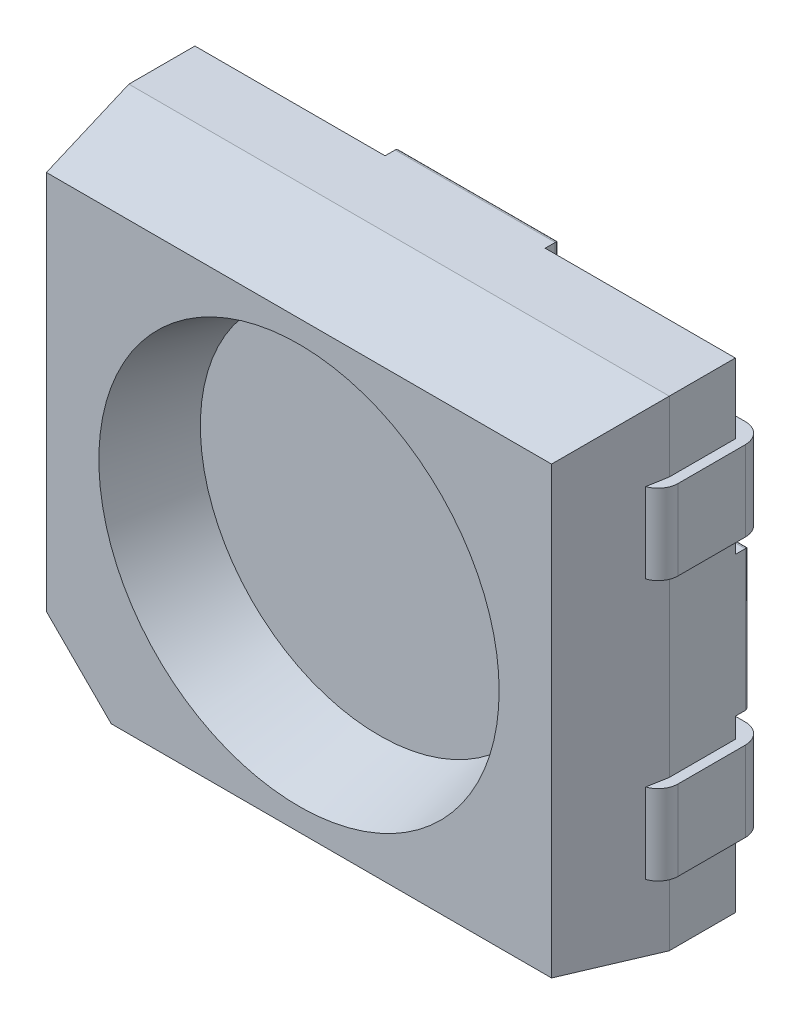
from build123d import *

# Parameters (mm, degrees)
BOSS_EXTRUDE1_START  = 0.03
SKETCH1_W            = 2.7
SKETCH1_H            = 2.4
BOSS_EXTRUDE1_DEPTH  = 0.4
BOSS_EXTRUDE2_START  = 0.43
SKETCH1_2_W          = 2.7
SKETCH1_2_H          = 2.4
BOSS_EXTRUDE2_DEPTH  = 0.5
BOSS_EXTRUDE2_TAPER  = 10
CUT_EXTRUDE1_DEPTH   = 0.3
SKETCH3_R            = 1
CUT_EXTRUDE2_DEPTH   = 0.4
CUT_EXTRUDE2_DRAFT   = -15
CUT_EXTRUDE3_DEPTH   = 0.07
BOSS_EXTRUDE3_START  = -0.5
SKETCH4_W            = 0.8
SKETCH4_H            = 0.4
BOSS_EXTRUDE3_DEPTH  = 0.53
FILLET2_R            = 0.1
MIRROR2_COPY_1_DEPTH = 0.07
FILLET1_R            = 0.02
FILLET2_OF_MIRROR3_R = 0.1
MIRROR4_START        = -0.85
MIRROR4_DEPTH        = 0.4


# Read off the part's stored shape, not the designer's step: Mirror4
with BuildPart() as part:
    # Sketch1 → Boss-Extrude1 (new body)
    with BuildSketch(Plane.XY.offset(BOSS_EXTRUDE1_START)):
        Rectangle(SKETCH1_W, SKETCH1_H)
    extrude(amount=BOSS_EXTRUDE1_DEPTH)

    # Sketch1<2> → Boss-Extrude2 (add)
    with BuildSketch(Plane.XY.offset(BOSS_EXTRUDE2_START)):
        Rectangle(SKETCH1_2_W, SKETCH1_2_H)
    extrude(amount=BOSS_EXTRUDE2_DEPTH, taper=BOSS_EXTRUDE2_TAPER)

    # Sketch2 → Cut-Extrude1 (cut)
    with BuildSketch(Plane.XY.offset(0.93)):
        Polygon((-0.85, -1.2), (-1.35, -0.7), (-1.35, -1.2), align=None)
    extrude(amount=-CUT_EXTRUDE1_DEPTH, mode=Mode.SUBTRACT)


with BuildPart() as cut_extrude2_tool:
    # Sketch3 → Cut-Extrude2 (with draft: the straight prism first)
    with BuildSketch(Plane.XY.offset(0.93)):
        Circle(SKETCH3_R)
    extrude(amount=-CUT_EXTRUDE2_DEPTH)
    # Cut-Extrude2: the draft: its side faces are tilted about the plane it starts from
    cut_extrude2_sides = [cut_extrude2_tool.faces().sort_by_distance(p)[0] for p in [
        (-1, 0, 0.73),
    ]]
    draft(cut_extrude2_sides, Plane.XY.offset(0.93), CUT_EXTRUDE2_DRAFT)


with BuildPart() as part_1:
    add(part.part)

    # Cut-Extrude2: cut by cut_extrude2_tool
    add(cut_extrude2_tool.part, mode=Mode.SUBTRACT)

    # Sketch5 → Cut-Extrude3 (cut)
    with BuildSketch(Plane(origin=(0, 0, 0.03), x_dir=(-1, 0, 0), z_dir=(0, 0, -1))):
        with BuildLine():
            Line((-1.35, 0.35), (-0.6, 0.35))
            ThreePointArc((-0.6, 0.35), (-0.458578644, 0.408578644), (-0.4, 0.55))
            Line((-0.4, 0.55), (-0.4, 1.2))
            Line((-0.4, 1.2), (-1.35, 1.2))
            Line((-1.35, 1.2), (-1.35, 0.35))
        make_face()
    cut_extrude3 = extrude(amount=-CUT_EXTRUDE3_DEPTH, mode=Mode.SUBTRACT)

    # Sketch4 → Boss-Extrude3 (add)
    with BuildSketch(Plane(origin=(0, 0, 0.03), x_dir=(-1, 0, 0), z_dir=(0, 0, -1)).offset(BOSS_EXTRUDE3_START)):
        with Locations((-1, 0.65)):
            Rectangle(SKETCH4_W, SKETCH4_H)
    boss_extrude3 = extrude(amount=BOSS_EXTRUDE3_DEPTH)

    # Fillet2
    # the kernel refuses this fillet: 0.1 mm, written as the material it takes off along each edge
    with BuildSketch(Plane(origin=(1.4, 0.21345775, 0.53), x_dir=(0, 0, -1), z_dir=(0, 1, 0))) as fillet2_piece_1:
        with BuildLine():
            CenterArc((0.0946169, 0.1), FILLET2_R, 198.885199637, 71.114800363)
            Line((0, 0.067632698), (-0.001892338, 0.066985352))
            ThreePointArc((-0.001892338, 0.066985352), (-0.002, 0.033816349), (-0.002, 0))
            Line((-0.002, 0), (0, -0.002))
            Line((0, -0.002), (0.0946169, -0.002))
            Line((0.0946169, -0.002), (0.0946169, 0))
        make_face()
    extrude(amount=0.8730845, mode=Mode.SUBTRACT)
    with BuildSketch(Plane(origin=(1.4, 0.2, 0), x_dir=(0, 0, 1), z_dir=(0, 1, 0))) as fillet2_piece_2:
        with BuildLine():
            CenterArc((FILLET2_R, -FILLET2_R), FILLET2_R, 90, 90)
            Line((0, -FILLET2_R), (-FILLET2_R * 0.02, -FILLET2_R))
            Line((-FILLET2_R * 0.02, -FILLET2_R), (-FILLET2_R * 0.02, FILLET2_R * 0.02))
            Line((-FILLET2_R * 0.02, FILLET2_R * 0.02), (FILLET2_R, FILLET2_R * 0.02))
            Line((FILLET2_R, FILLET2_R * 0.02), (FILLET2_R, 0))
        make_face()
    extrude(amount=0.9, mode=Mode.SUBTRACT)

    # Mirror1: Cut-Extrude3 across plane
    add(cut_extrude3.mirror(Plane(origin=(0, 0, 0), x_dir=(0, 0, 1), z_dir=(1, 0, 0))), mode=Mode.SUBTRACT)

    # Mirror2: Cut-Extrude3 across plane
    add(cut_extrude3.mirror(Plane.ZX), mode=Mode.SUBTRACT)

    # Mirror2 copy 1 sketch → Mirror2 copy 1 (cut)
    with BuildSketch(Plane(origin=(0, 0, 0.03), x_dir=(1, 0, 0), z_dir=(0, 0, -1))):
        with BuildLine():
            Line((-1.35, 0.35), (-0.6, 0.35))
            ThreePointArc((-0.6, 0.35), (-0.458578644, 0.408578644), (-0.4, 0.55))
            Line((-0.4, 0.55), (-0.4, 1.2))
            Line((-0.4, 1.2), (-1.35, 1.2))
            Line((-1.35, 1.2), (-1.35, 0.35))
        make_face()
    extrude(amount=-MIRROR2_COPY_1_DEPTH, mode=Mode.SUBTRACT)

    # Fillet1
    fillet1_edges = [part_1.edges().sort_by_distance(p)[0] for p in [
        (-1.35, 0, 0.03),
        (-0.458578644, 0.408578644, 0.03),
        (-0.4, 0.875, 0.03),
        (-0.975, 0.35, 0.03),
        (0, -1.2, 0.03),
        (-0.458578644, -0.408578644, 0.03),
        (-0.4, -0.875, 0.03),
        (-0.975, -0.35, 0.03),
        (1.35, 0, 0.03),
        (0.458578644, -0.408578644, 0.03),
        (0.4, -0.875, 0.03),
        (0.975, -0.35, 0.03),
        (0, 1.2, 0.03),
        (0.458578644, 0.408578644, 0.03),
        (0.4, 0.875, 0.03),
        (0.975, 0.35, 0.03),
    ]]
    fillet(fillet1_edges, radius=FILLET1_R)

    # Mirror3: Boss-Extrude3 across plane
    add(boss_extrude3.mirror(Plane(origin=(0, 0, 0), x_dir=(0, 0, 1), z_dir=(1, 0, 0))))

    # Fillet2 of Mirror3
    # the kernel refuses this fillet: 0.1 mm, written as the material it takes off along each edge
    with BuildSketch(Plane(origin=(-1.4, 0.21345775, 0.53), x_dir=(0, 0, -1), z_dir=(0, 1, 0))) as fillet2_of_mirror3_piece_1:
        with BuildLine():
            CenterArc((0.0946169, -0.1), FILLET2_OF_MIRROR3_R, 90, 71.114800363)
            Line((0, -0.067632698), (-0.001892338, -0.066985352))
            ThreePointArc((-0.001892338, -0.066985352), (-0.002, -0.033816349), (-0.002, 0))
            Line((-0.002, 0), (0, 0.002))
            Line((0, 0.002), (0.0946169, 0.002))
            Line((0.0946169, 0.002), (0.0946169, 0))
        make_face()
    extrude(amount=0.8730845, mode=Mode.SUBTRACT)
    with BuildSketch(Plane(origin=(-1.4, 0.2, 0), x_dir=(0, 0, 1), z_dir=(0, 1, 0))) as fillet2_of_mirror3_piece_2:
        with BuildLine():
            CenterArc((FILLET2_OF_MIRROR3_R, FILLET2_OF_MIRROR3_R), FILLET2_OF_MIRROR3_R, 180, 90)
            Line((0, FILLET2_OF_MIRROR3_R), (-FILLET2_OF_MIRROR3_R * 0.02, FILLET2_OF_MIRROR3_R))
            Line((-FILLET2_OF_MIRROR3_R * 0.02, FILLET2_OF_MIRROR3_R), (-FILLET2_OF_MIRROR3_R * 0.02, -FILLET2_OF_MIRROR3_R * 0.02))
            Line((-FILLET2_OF_MIRROR3_R * 0.02, -FILLET2_OF_MIRROR3_R * 0.02), (FILLET2_OF_MIRROR3_R, -FILLET2_OF_MIRROR3_R * 0.02))
            Line((FILLET2_OF_MIRROR3_R, -FILLET2_OF_MIRROR3_R * 0.02), (FILLET2_OF_MIRROR3_R, 0))
        make_face()
    extrude(amount=0.9, mode=Mode.SUBTRACT)

    # Mirror4 outline → Mirror4 (add)
    with BuildSketch(Plane(origin=(0, 0, 0), x_dir=(1, 0, 0), z_dir=(0, 1, 0)).offset(MIRROR4_START)):
        with BuildLine():
            Line((1.4, -0.4353831), (1.4, -0.1))
            ThreePointArc((1.4, -0.1), (1.370710678, -0.029289322), (1.3, 0))
            Line((1.3, 0), (0.6, 0))
            Line((0.6, 0), (0.6, -0.1))
            Line((0.6, -0.1), (1.35, -0.1))
            Line((1.35, -0.1), (1.35, -0.43))
            Line((1.35, -0.43), (1.332367302, -0.53))
            ThreePointArc((1.332367302, -0.53), (1.381353335, -0.493534926), (1.4, -0.4353831))
        make_face()
        with BuildLine():
            Line((-0.6, 0), (-1.3, 0))
            ThreePointArc((-1.3, 0), (-1.370710678, -0.029289322), (-1.4, -0.1))
            Line((-1.4, -0.1), (-1.4, -0.4353831))
            ThreePointArc((-1.4, -0.4353831), (-1.381353335, -0.493534926), (-1.332367302, -0.53))
            Line((-1.332367302, -0.53), (-1.35, -0.43))
            Line((-1.35, -0.43), (-1.35, -0.1))
            Line((-1.35, -0.1), (-0.6, -0.1))
            Line((-0.6, -0.1), (-0.6, 0))
        make_face()
    extrude(amount=MIRROR4_DEPTH)


solid = part_1.part
